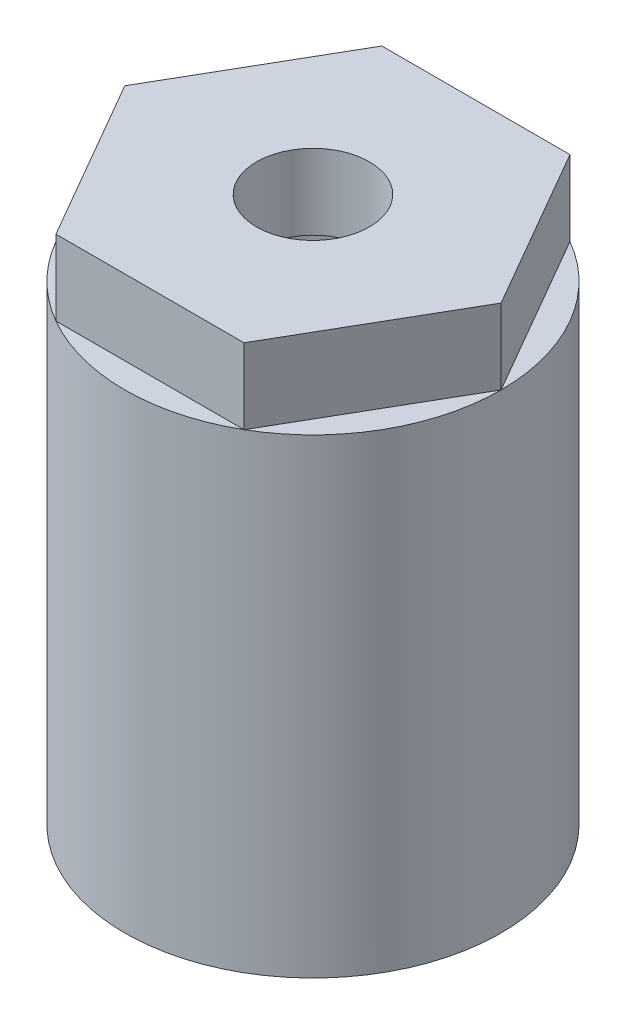
from build123d import *

# Parameters (mm, degrees)
SCHIZZO2_R               = 6
TAGLIO_ESTRUSIONE1_DEPTH = 11
SCHIZZO3_R               = 0.5
SCHIZZO3_R_2             = 1.5
TAGLIO_ESTRUSIONE2_DEPTH = 10
RACCORDO1_R              = 0.5
TAGLIO_ESTRUSIONE3_START = -8
TAGLIO_ESTRUSIONE3_DEPTH = 8


with BuildPart() as part:
    # Schizzo1 → Rivoluzione1 (revolve)
    with BuildSketch(Plane.XY):
        Polygon((-15, 5), (-14, 6), (-14, 38), (0, 38), (0, 46), (-20, 46), (-20, -12), (-18, -12), (-18, 0), (-15, 0), align=None)
    revolve(axis=Axis((0, 0, 0), (0, 1, 0)))

    # Schizzo2 → Taglio-Estrusione1 (cut)
    with BuildSketch(Plane(origin=(0, 46, 0), x_dir=(1, 0, 0), z_dir=(0, 1, 0))):
        Circle(SCHIZZO2_R)
    extrude(amount=-TAGLIO_ESTRUSIONE1_DEPTH, mode=Mode.SUBTRACT)

    # Schizzo3 → Taglio-Estrusione2 (cut)
    with BuildSketch(Plane(origin=(0, 0, -20), x_dir=(-1, 0, 0), z_dir=(0, 0, -1))):
        with Locations((0, 26)):
            Circle(SCHIZZO3_R)
        with Locations((0, 4)):
            Circle(SCHIZZO3_R_2)
    extrude(amount=-TAGLIO_ESTRUSIONE2_DEPTH, mode=Mode.SUBTRACT)

    # Raccordo1
    raccordo1_edges = [part.edges().sort_by_distance(p)[0] for p in [
        (14, 38, 0),
    ]]
    fillet(raccordo1_edges, radius=RACCORDO1_R)

    # Schizzo4 → Taglio-Estrusione3 (cut)
    with BuildSketch(Plane(origin=(0, 46, 0), x_dir=(1, 0, 0), z_dir=(0, 1, 0)).offset(TAGLIO_ESTRUSIONE3_START)):
        with BuildLine():
            ThreePointArc((10, 17.320508076), (0, 20), (-10, 17.320508076))
            Line((-10, 17.320508076), (10, 17.320508076))
        make_face()
        with BuildLine():
            Line((-20, 0), (-10, 17.320508076))
            ThreePointArc((-10, 17.320508076), (-17.320508076, 10), (-20, 0))
        make_face()
        with BuildLine():
            Line((-10, -17.320508076), (-20, 0))
            ThreePointArc((-20, 0), (-17.320508076, -10), (-10, -17.320508076))
        make_face()
        with BuildLine():
            ThreePointArc((20, 0), (17.320508076, 10), (10, 17.320508076))
            Line((10, 17.320508076), (20, 0))
        make_face()
        with BuildLine():
            Line((10, -17.320508076), (-10, -17.320508076))
            ThreePointArc((-10, -17.320508076), (0, -20), (10, -17.320508076))
        make_face()
        with BuildLine():
            ThreePointArc((10, -17.320508076), (17.320508076, -10), (20, 0))
            Line((20, 0), (10, -17.320508076))
        make_face()
    extrude(amount=TAGLIO_ESTRUSIONE3_DEPTH, mode=Mode.SUBTRACT)


solid = part.part
